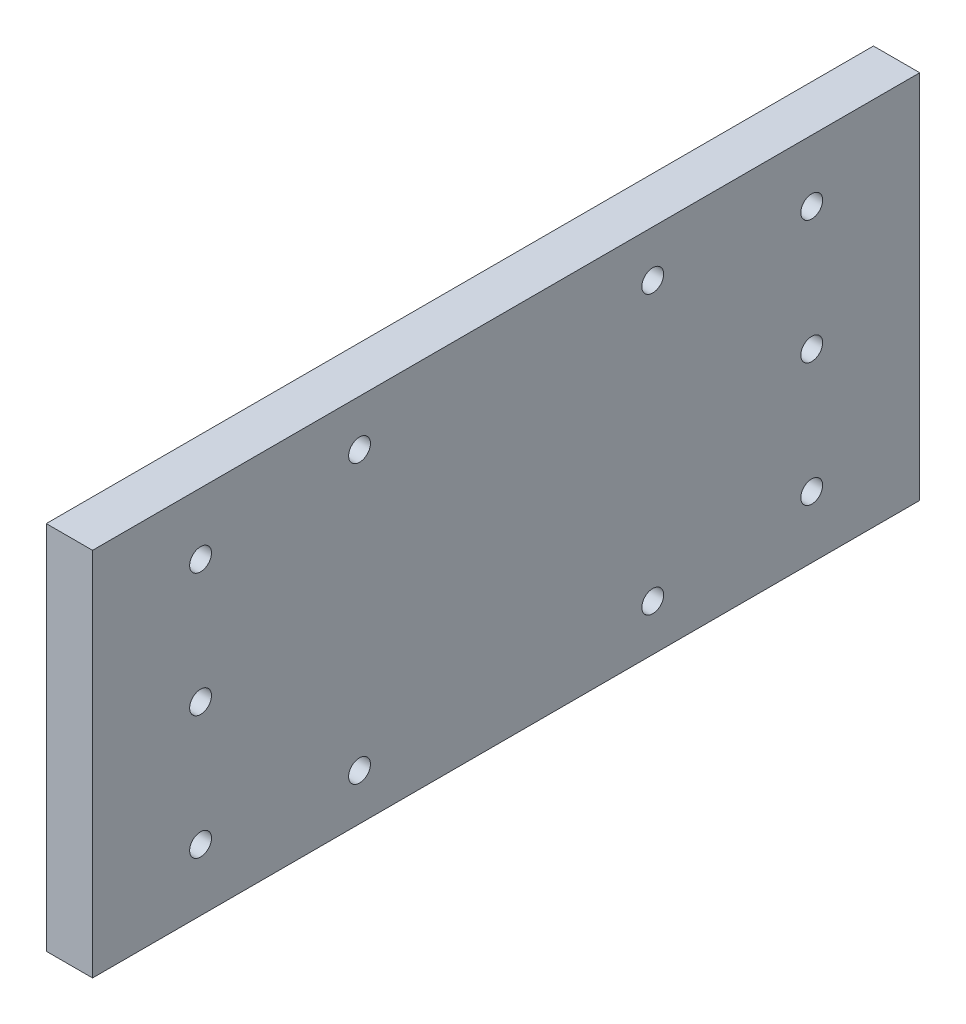
from build123d import *

# Parameters (mm, degrees)
SKETCH1_W             = 9.525
SKETCH1_H             = 76.2
BOSS_EXTRUDE1_DEPTH   = 170.18
F_8_CLEARANCE_HOLE1_D = 4.4958
F_8_CLEARANCE_HOLE2_D = 4.4958


with BuildPart() as part:
    # Sketch1 → Boss-Extrude1 (new body)
    with BuildSketch(Plane.XY):
        Rectangle(SKETCH1_W, SKETCH1_H)
    extrude(amount=BOSS_EXTRUDE1_DEPTH)

    # #8 Clearance Hole1 (through all)
    with Locations(Plane(origin=(4.7625, 0, 0), x_dir=(0, 0, -1), z_dir=(1, 0, 0))):
        with Locations((-147.955, 25.4), (-147.955, 0), (-147.955, -25.4), (-22.225, 25.4), (-22.225, 0), (-22.225, -25.4)):
            Hole(F_8_CLEARANCE_HOLE1_D / 2)

    # #8 Clearance Hole2 (through all)
    with Locations(Plane(origin=(4.7625, 0, 0), x_dir=(0, 0, -1), z_dir=(1, 0, 0))):
        with Locations((-115.2525, 28.575), (-54.9275, 28.575), (-54.9275, -28.575), (-115.2525, -28.575)):
            Hole(F_8_CLEARANCE_HOLE2_D / 2)


solid = part.part
